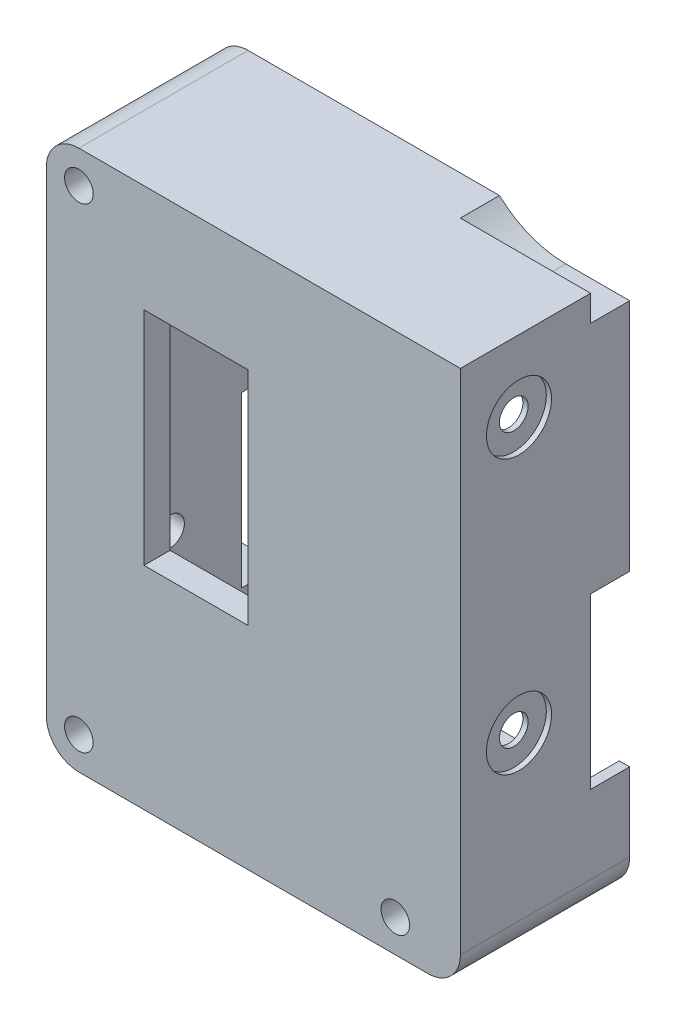
from build123d import *

# Parameters (mm, degrees)
SKETCH_1_R          = 1.1
SKETCH_1_W          = 26
SKETCH_1_H          = 32.5
EXTRUDE_1_DEPTH     = 11
SKETCH_3_R          = 1.1
EXTRUDE_2_DEPTH     = 2
SKETCH_2_R          = 1.1
CUT_EXTRUDE_1_DEPTH = 50.401315772
SKETCH_4_W          = 8
SKETCH_4_H          = 17
CUT_EXTRUDE_3_DEPTH = 10
SKETCH_5_R          = 2.5
CUT_EXTRUDE_4_DEPTH = 0.4
SKETCH_6_W          = 3.5
SKETCH_6_H          = 13
SKETCH_6_W_2        = 10
SKETCH_6_H_2        = 2
CUT_EXTRUDE_6_DEPTH = 3
FILLET_1_R          = 7.5
SKETCH_7_W          = 3
SKETCH_7_H          = 13
CUT_EXTRUDE_7_DEPTH = 49.449355001


with BuildPart() as part:
    # ｽｹｯﾁ1 → ﾎﾞｽ - 押し出し1 (new body)
    with BuildSketch(Plane.XY):
        with BuildLine():
            Line((26.8, 35.5), (26.8, -3.5))
            ThreePointArc((26.8, -3.5), (26.067766953, -5.267766953), (24.3, -6))
            Line((24.3, -6), (-2.5, -6))
            ThreePointArc((-2.5, -6), (-4.267766953, -5.267766953), (-5, -3.5))
            Line((-5, -3.5), (-5, 33))
            ThreePointArc((-5, 33), (-4.267766953, 34.767766953), (-2.5, 35.5))
            Line((-2.5, 35.5), (26.8, 35.5))
        make_face()
        with Locations((-2.5, 33)):
            Circle(SKETCH_1_R, mode=Mode.SUBTRACT)
        with Locations((-2.5, -3.5)):
            Circle(SKETCH_1_R, mode=Mode.SUBTRACT)
        with Locations((21.8, -3.5)):
            Circle(SKETCH_1_R, mode=Mode.SUBTRACT)
        with Locations((13, 16.25)):
            Rectangle(SKETCH_1_W, SKETCH_1_H, mode=Mode.SUBTRACT)
    extrude(amount=EXTRUDE_1_DEPTH)

    # ｽｹｯﾁ3 → ﾎﾞｽ - 押し出し2 (add)
    with BuildSketch(Plane(origin=(0, 0, 11), x_dir=(-1, 0, 0), z_dir=(0, 0, -1))):
        with BuildLine():
            Line((5, -3.5), (5, 33))
            ThreePointArc((5, 33), (4.267766953, 34.767766953), (2.5, 35.5))
            Line((2.5, 35.5), (-26.8, 35.5))
            Line((-26.8, 35.5), (-26.8, -3.5))
            ThreePointArc((-26.8, -3.5), (-26.067766953, -5.267766953), (-24.3, -6))
            Line((-24.3, -6), (2.5, -6))
            ThreePointArc((2.5, -6), (4.267766953, -5.267766953), (5, -3.5))
        make_face()
        with Locations((-21.8, -3.5)):
            Circle(SKETCH_3_R, mode=Mode.SUBTRACT)
        with Locations((2.5, -3.5)):
            Circle(SKETCH_3_R, mode=Mode.SUBTRACT)
        with Locations((2.5, 33)):
            Circle(SKETCH_3_R, mode=Mode.SUBTRACT)
    extrude(amount=-EXTRUDE_2_DEPTH)

    # ｽｹｯﾁ2 → ｶｯﾄ - 押し出し1 (cut, through all)
    with BuildSketch(Plane.ZY.offset(5)):
        with Locations(Location((8.5, 30, 0), (0, 0, 270))):
            Circle(SKETCH_2_R)
        with Locations(Location((8.5, 9, 0), (0, 0, 270))):
            Circle(SKETCH_2_R)
    extrude(amount=-CUT_EXTRUDE_1_DEPTH, mode=Mode.SUBTRACT)

    # ｽｹｯﾁ4 → ｶｯﾄ - 押し出し3 (cut)
    with BuildSketch(Plane.XY.offset(13)):
        with Locations((6.5, 18.75)):
            Rectangle(SKETCH_4_W, SKETCH_4_H)
    extrude(amount=-CUT_EXTRUDE_3_DEPTH, mode=Mode.SUBTRACT)

    # ｽｹｯﾁ5 → ｶｯﾄ - 押し出し4 (cut)
    with BuildSketch(Plane(origin=(26.8, 0, 0), x_dir=(0, 0, -1), z_dir=(1, 0, 0))):
        with Locations((-8.5, 30)):
            Circle(SKETCH_5_R)
        with Locations((-8.5, 9)):
            Circle(SKETCH_5_R)
    extrude(amount=-CUT_EXTRUDE_4_DEPTH, mode=Mode.SUBTRACT)

    # ｽｹｯﾁ6 → ｶｯﾄ - 押し出し6 (cut)
    with BuildSketch(Plane(origin=(0, 0, 0), x_dir=(-1, 0, 0), z_dir=(0, 0, -1))):
        with Locations((1.75, 9)):
            Rectangle(SKETCH_6_W, SKETCH_6_H)
        with Locations((-21.8, 34.5)):
            Rectangle(SKETCH_6_W_2, SKETCH_6_H_2)
    extrude(amount=-CUT_EXTRUDE_6_DEPTH, mode=Mode.SUBTRACT)

    # ﾌｨﾚｯﾄ1
    # the kernel refuses this fillet: 7.5 mm, written as the material it adds along each edge
    with BuildSketch(Plane(origin=(16.8, 33.5, 0), x_dir=(0, 1, 0), z_dir=(0, 0, 1))) as fillet_1_piece_1:
        with BuildLine():
            CenterArc((7.5, -5.099019514), FILLET_1_R, 137.166571934, 42.833428066)
            Line((0, -5.099019514), (0, 0))
            Line((0, 0), (2, 0))
        make_face()
    extrude(amount=3)

    # ｽｹｯﾁ7 → ｶｯﾄ - 押し出し7 (cut, through all)
    with BuildSketch(Plane(origin=(-3.5, 0, 0), x_dir=(0, 0, -1), z_dir=(1, 0, 0))):
        with Locations((-1.5, 9)):
            Rectangle(SKETCH_7_W, SKETCH_7_H)
    extrude(amount=CUT_EXTRUDE_7_DEPTH, mode=Mode.SUBTRACT)


solid = part.part
